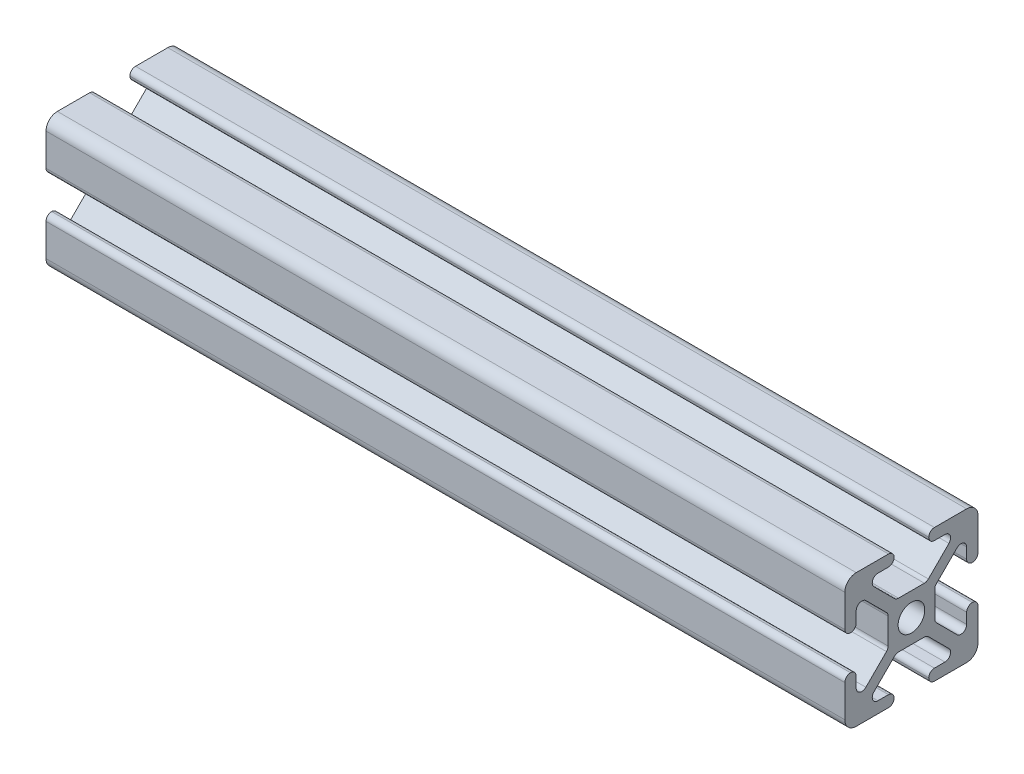
from build123d import *

# Parameters (mm, degrees)
SKETCH1_R           = 2.5
BOSS_EXTRUDE1_DEPTH = 150
FILLET1_R           = 1.065
FILLET2_R           = 2.13


with BuildPart() as part:
    # Sketch1 → Boss-Extrude1 (new body)
    with BuildSketch(Plane.YZ):
        Polygon((-12.5, -3.25), (-12.5, -12.5), (-3.25, -12.5), (-3.25, -10.37), (-8.863862556, -10.37), (-2.873862556, -4.38), (2.873862556, -4.38), (8.863862556, -10.37), (3.25, -10.37), (3.25, -12.5), (12.5, -12.5), (12.5, -3.25), (10.37, -3.25), (10.37, -8.863862556), (4.38, -2.873862556), (4.38, 2.873862556), (10.37, 8.863862556), (10.37, 3.25), (12.5, 3.25), (12.5, 12.5), (3.25, 12.5), (3.25, 10.37), (8.863862556, 10.37), (2.873862556, 4.38), (-2.873862556, 4.38), (-8.863862556, 10.37), (-3.25, 10.37), (-3.25, 12.5), (-12.5, 12.5), (-12.5, 3.25), (-10.37, 3.25), (-10.37, 8.863862556), (-4.38, 2.873862556), (-4.38, -2.873862556), (-10.37, -8.863862556), (-10.37, -3.25), align=None)
        with Locations(Location((0, 0, 0), (0, 0, 270))):
            Circle(SKETCH1_R, mode=Mode.SUBTRACT)
    extrude(amount=BOSS_EXTRUDE1_DEPTH)

    # Fillet1
    fillet1_edges = [part.edges().sort_by_distance(p)[0] for p in [
        (75, -10.37, -8.863862556),
        (75, 2.873862556, -4.38),
        (75, -2.873862556, -4.38),
        (75, -4.38, 2.873862556),
        (75, -4.38, -2.873862556),
        (75, -2.873862556, 4.38),
        (75, 2.873862556, 4.38),
        (75, 4.38, 2.873862556),
        (75, 4.38, -2.873862556),
        (75, -8.863862556, -10.37),
        (75, 8.863862556, -10.37),
        (75, 10.37, -8.863862556),
        (75, -10.37, 8.863862556),
        (75, -8.863862556, 10.37),
        (75, 10.37, 8.863862556),
        (75, 8.863862556, 10.37),
        (75, 12.5, 3.25),
        (75, -3.25, -12.5),
        (75, -10.37, 3.25),
        (75, 10.37, 3.25),
        (75, -10.37, -3.25),
        (75, -12.5, -3.25),
        (75, -12.5, 3.25),
        (75, 3.25, -10.37),
        (75, -3.25, -10.37),
        (75, 3.25, -12.5),
        (75, 10.37, -3.25),
        (75, 12.5, -3.25),
        (75, 3.25, 12.5),
        (75, 3.25, 10.37),
        (75, -3.25, 10.37),
        (75, -3.25, 12.5),
    ]]
    fillet(fillet1_edges, radius=FILLET1_R - 0.0001)  # a hair under: the kernel refuses the full size

    # Fillet2
    fillet2_edges = [part.edges().sort_by_distance(p)[0] for p in [
        (75, -12.5, 12.5),
        (75, 12.5, 12.5),
        (75, 12.5, -12.5),
        (75, -12.5, -12.5),
    ]]
    fillet(fillet2_edges, radius=FILLET2_R)


solid = part.part
